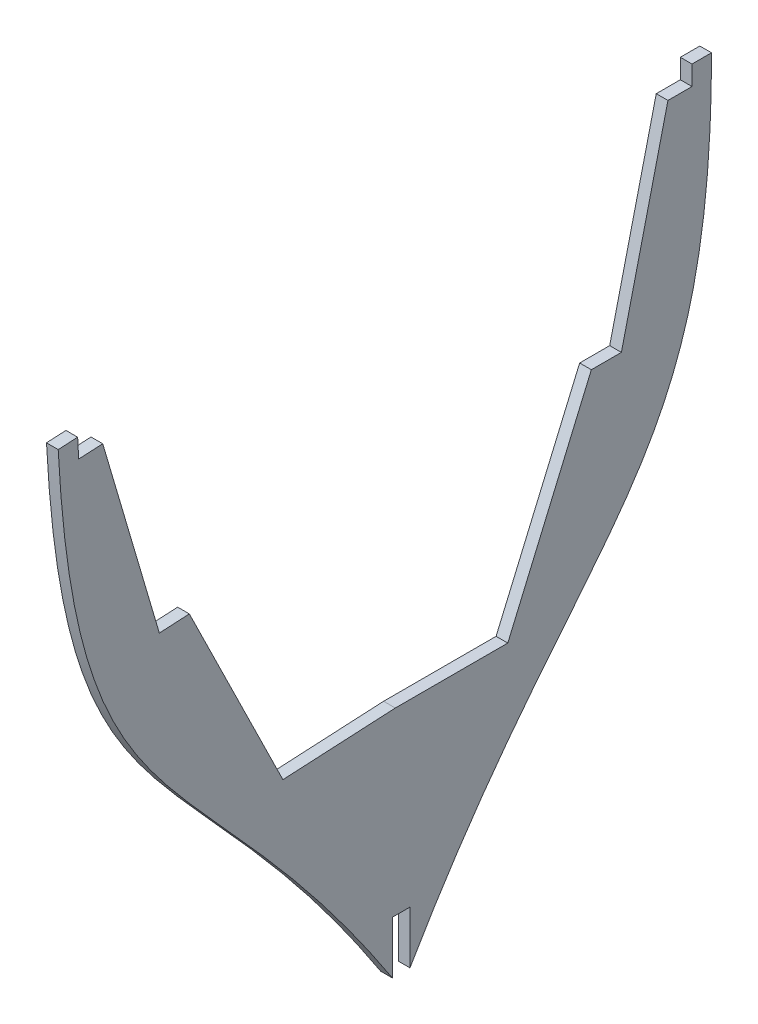
from build123d import *

# Parameters (mm, degrees)
BOSS_EXTRU_3_DEPTH      = 6
ENL_V_MAT_EXTRU_1_DEPTH = 6


with BuildPart() as part:
    # Esquisse2 → Boss.-Extru.3 (new body)
    with BuildSketch(Plane(origin=(0, 0, 0), x_dir=(0, 0, -1), z_dir=(1, 0, 0))):
        with BuildLine():
            Line((158.688577112, 362.336280449), (148.688577112, 362.336280449))
            Line((148.688577112, 362.336280449), (148.688577112, 352.336280449))
            Line((148.688577112, 352.336280449), (136.338047582, 352.336280449))
            Line((136.338047582, 352.336280449), (112.460831752, 252.336280449))
            Line((112.460831752, 252.336280449), (97.044751516, 252.336280449))
            Line((97.044751516, 252.336280449), (54.179079019, 152.336280449))
            Line((54.179079019, 152.336280449), (-3.535851595, 152.336280449))
            Line((-3.535851595, 152.336280449), (-61.172675306, 149.334652839))
            Line((-61.172675306, 149.334652839), (-109.181118536, 246.969970512))
            Line((-109.181118536, 246.969970512), (-124.576335847, 246.168213816))
            Line((-124.576335847, 246.168213816), (-153.622019913, 344.791079689))
            Line((-153.622019913, 344.791079689), (-165.955835196, 344.148755596))
            Line((-165.955835196, 344.148755596), (-166.475913376, 354.135222373))
            Line((-166.475913376, 354.135222373), (-176.462380153, 353.615144193))
            add(Edge.make_bspline(
                [(-176.462380153, 353.615144193), (-166.669311378, 165.570039356), (-103.175829378, 187.382137158), (-0.241302153, 25.727617675)],
                knots=[0, 0, 0, 0, 1, 1, 1, 1], degree=3))
            add(Edge.make_bspline(
                [(158.688577112, 362.336280449), (158.688577112, 174.036345108), (94.146622645, 192.516766653), (-0.241302153, 25.727617675)],
                knots=[0, 0, 0, 0, 1, 1, 1, 1], degree=3))
        make_face()
    extrude(amount=BOSS_EXTRU_3_DEPTH)

    # Esquisse3 → Enlèv. mat.-Extru.1 (cut)
    with BuildSketch(Plane(origin=(6, 0, 0), x_dir=(0, 0, -1), z_dir=(1, 0, 0))):
        Polygon((-5.005781851, 33.123764181), (-5.005781851, 60.123764181), (3.994218149, 60.123764181), (3.994218149, 33.123764181), (20.148412149, 15.237368104), (-16.196929823, 12.740359877), align=None)
    extrude(amount=-ENL_V_MAT_EXTRU_1_DEPTH, mode=Mode.SUBTRACT)


solid = part.part
